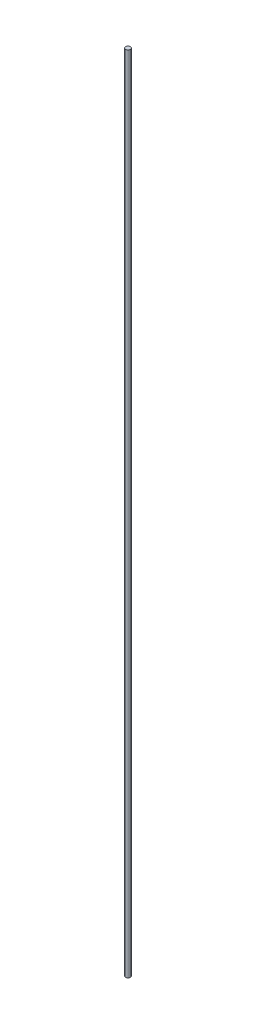
from build123d import *

# Parameters (mm, degrees)
SKETCH_2_W = 2.5
SKETCH_2_H = 831.25


with BuildPart() as part:
    # Эскиз2 → Повернуть1 (revolve)
    with BuildSketch(Plane.XY):
        with Locations((-1.25, -74.975594317)):
            Rectangle(SKETCH_2_W, SKETCH_2_H)
    revolve(axis=Axis((-2.5, 340.649405683, 0), (0, -1, 0)))


solid = part.part
